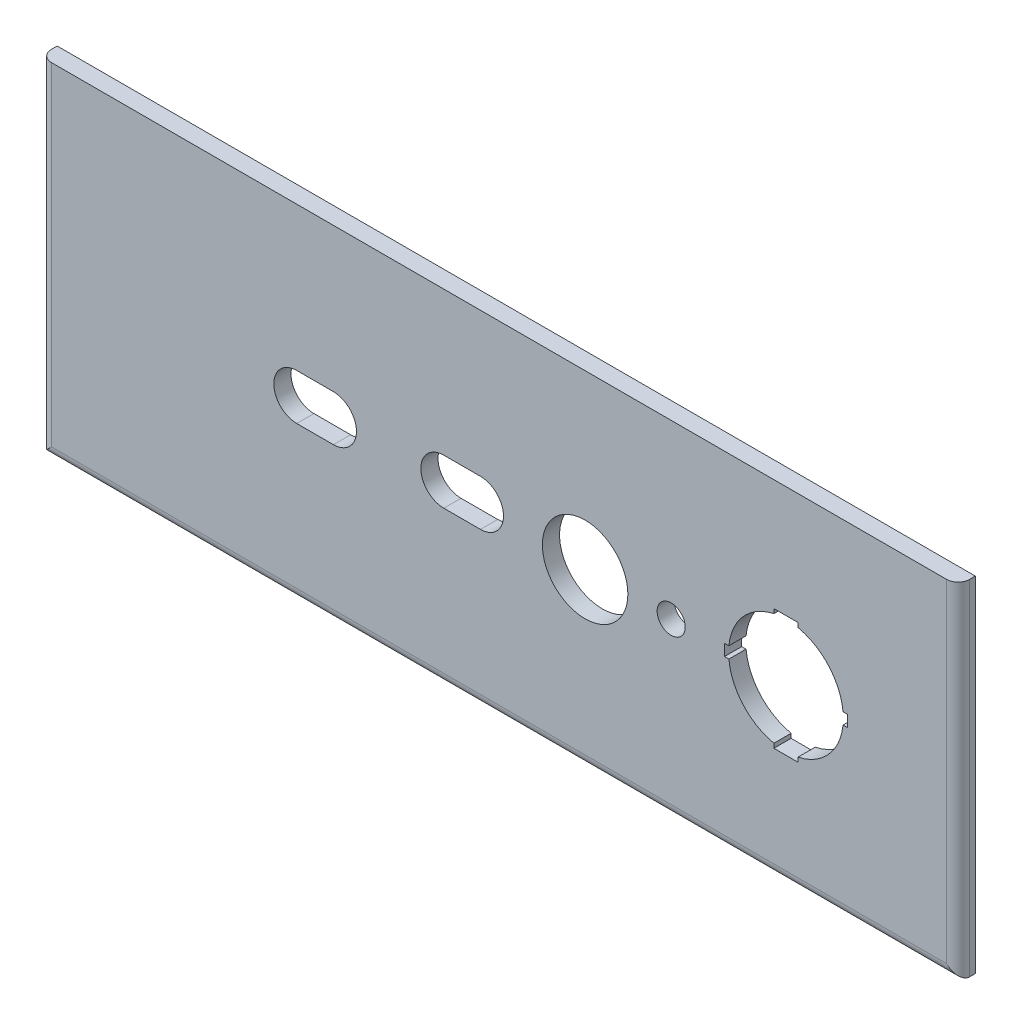
from build123d import *

# Parameters (mm, degrees)
SKETCH11_W          = 160
SKETCH11_H          = 60
SKETCH11_R          = 7.45
SKETCH11_R_2        = 2.45
BOSS_EXTRUDE1_DEPTH = 3
FILLET1_R           = 2


with BuildPart() as part:
    # Sketch11 → Boss-Extrude1 (new body)
    with BuildSketch(Plane.XY):
        with Locations((-80, 30)):
            Rectangle(SKETCH11_W, SKETCH11_H)
        with BuildLine():
            ThreePointArc((-115.252753418, 26.9), (-119.252753418, 30.9), (-115.252753418, 34.9))
            Line((-115.252753418, 34.9), (-108.852753418, 34.9))
            ThreePointArc((-108.852753418, 34.9), (-104.852753418, 30.9), (-108.852753418, 26.9))
            Line((-108.852753418, 26.9), (-115.252753418, 26.9))
        make_face(mode=Mode.SUBTRACT)
        with BuildLine():
            ThreePointArc((-89.627304882, 26.930328357), (-93.627304882, 30.930328357), (-89.627304882, 34.930328357))
            Line((-89.627304882, 34.930328357), (-83.227304882, 34.930328357))
            ThreePointArc((-83.227304882, 34.930328357), (-79.227304882, 30.930328357), (-83.227304882, 26.930328357))
            Line((-83.227304882, 26.930328357), (-89.627304882, 26.930328357))
        make_face(mode=Mode.SUBTRACT)
        with Locations((-65, 30)):
            Circle(SKETCH11_R, mode=Mode.SUBTRACT)
        with Locations((-50, 30)):
            Circle(SKETCH11_R_2, mode=Mode.SUBTRACT)
        with BuildLine():
            Line((-40.703387314, 31), (-39.949874371, 31))
            ThreePointArc((-39.949874371, 31), (-37.453781668, 36.666418742), (-32.1, 39.777013859))
            Line((-32.1, 39.777013859), (-32.1, 40.542888598))
            Line((-32.1, 40.542888598), (-27.9, 40.542888598))
            Line((-27.9, 40.542888598), (-27.9, 39.777013859))
            ThreePointArc((-27.9, 39.777013859), (-22.546218332, 36.666418742), (-20.050125629, 31))
            Line((-20.050125629, 31), (-19.296612686, 31))
            Line((-19.296612686, 31), (-19.296612686, 29))
            Line((-19.296612686, 29), (-20.050125629, 29))
            ThreePointArc((-20.050125629, 29), (-22.546218332, 23.333581258), (-27.9, 20.222986141))
            Line((-27.9, 20.222986141), (-27.9, 19.457111402))
            Line((-27.9, 19.457111402), (-32.1, 19.457111402))
            Line((-32.1, 19.457111402), (-32.1, 20.222986141))
            ThreePointArc((-32.1, 20.222986141), (-37.453781668, 23.333581258), (-39.949874371, 29))
            Line((-39.949874371, 29), (-40.703387314, 29))
            Line((-40.703387314, 29), (-40.703387314, 31))
        make_face(mode=Mode.SUBTRACT)
    extrude(amount=BOSS_EXTRUDE1_DEPTH)

    # Fillet1
    fillet1_edges = [part.edges().sort_by_distance(p)[0] for p in [
        (-80, 0, 3),
        (-160, 30, 3),
        (0, 30, 3),
    ]]
    fillet(fillet1_edges, radius=FILLET1_R)


solid = part.part
